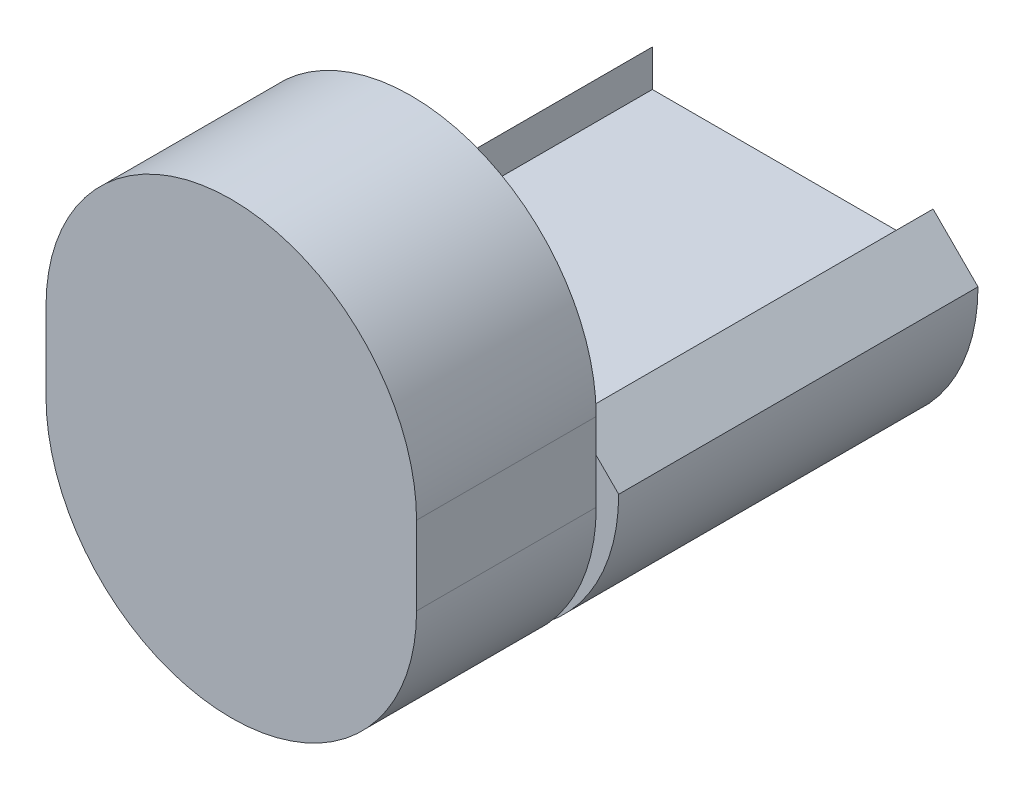
from build123d import *

# Parameters (mm, degrees)
BOSS_EXTRUDE1_DEPTH = 101.6
BOSS_EXTRUDE2_DEPTH = 50.8


with BuildPart() as part:
    # Sketch1 → Boss-Extrude1 (new body)
    with BuildSketch(Plane.XY):
        with BuildLine():
            Line((-39.6875, -2.63525), (39.6875, -2.63525))
            Line((39.6875, -2.63525), (39.6875, 7.77875))
            Line((39.6875, 7.77875), (52.3875, -4.92125))
            ThreePointArc((52.3875, -4.92125), (0, -57.30875), (-52.3875, -4.92125))
            Line((-52.3875, -4.92125), (-39.6875, 7.77875))
            Line((-39.6875, 7.77875), (-39.6875, -2.63525))
        make_face()
    extrude(amount=BOSS_EXTRUDE1_DEPTH)


with BuildPart() as body_2:
    # Sketch3 → Boss-Extrude2 (new body)
    with BuildSketch(Plane.XY.offset(158.75)):
        with BuildLine():
            Line((-52.3875, -4.92125), (-52.3875, 17.30375))
            ThreePointArc((-52.3875, 17.30375), (0, 69.69125), (52.3875, 17.30375))
            Line((52.3875, 17.30375), (52.3875, -4.92125))
            ThreePointArc((52.3875, -4.92125), (0, -57.30875), (-52.3875, -4.92125))
        make_face()
    extrude(amount=-BOSS_EXTRUDE2_DEPTH)


solid = Compound([part.part, body_2.part])
